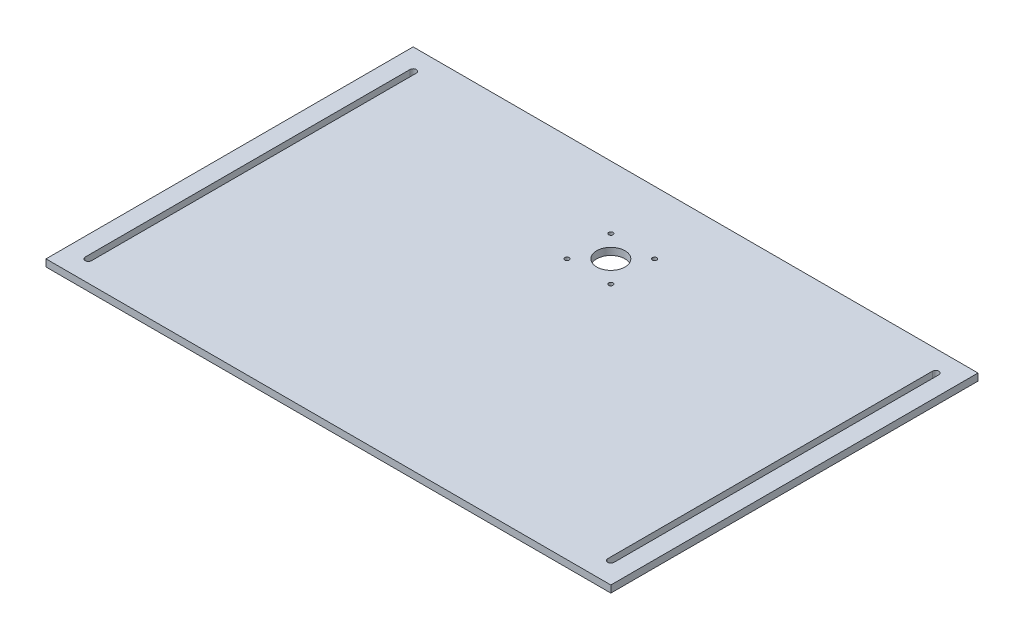
from build123d import *

# Parameters (mm, degrees)
SKETCH_1_W          = 400
SKETCH_1_H          = 260
EXTRUDE_1_DEPTH     = 5
CUT_EXTRUDE_1_DEPTH = 239.589605809
SKETCH_3_R          = 1.55
SKETCH_3_R_2        = 10
CUT_EXTRUDE_2_DEPTH = 239.589605809


with BuildPart() as part:
    # 草圖1 → 填料-伸長1 (new body)
    with BuildSketch(Plane(origin=(0, 0, 0), x_dir=(1, 0, 0), z_dir=(0, 1, 0))):
        Rectangle(SKETCH_1_W, SKETCH_1_H)
    extrude(amount=EXTRUDE_1_DEPTH)

    # 草圖2 → 除料-伸長1 (cut, through all)
    with BuildSketch(Plane(origin=(0, 5, 0), x_dir=(1, 0, 0), z_dir=(0, 1, 0))):
        with BuildLine():
            Line((-182.75, 115), (-182.75, -115))
            ThreePointArc((-182.75, -115), (-185, -117.25), (-187.25, -115))
            Line((-187.25, -115), (-187.25, 115))
            ThreePointArc((-187.25, 115), (-185, 117.25), (-182.75, 115))
        make_face()
        with BuildLine():
            Line((182.75, 115), (182.75, -115))
            ThreePointArc((182.75, -115), (185, -117.25), (187.25, -115))
            Line((187.25, -115), (187.25, 115))
            ThreePointArc((187.25, 115), (185, 117.25), (182.75, 115))
        make_face()
    extrude(amount=-CUT_EXTRUDE_1_DEPTH, mode=Mode.SUBTRACT)

    # 草圖3 → 除料-伸長2 (cut, through all)
    with BuildSketch(Plane(origin=(0, 5, 0), x_dir=(1, 0, 0), z_dir=(0, 1, 0))):
        with Locations((-15.5, 85.5)):
            Circle(SKETCH_3_R)
        with Locations((15.5, 85.5)):
            Circle(SKETCH_3_R)
        with Locations((-15.5, 54.5)):
            Circle(SKETCH_3_R)
        with Locations((15.5, 54.5)):
            Circle(SKETCH_3_R)
        with Locations((0, 70)):
            Circle(SKETCH_3_R_2)
    extrude(amount=-CUT_EXTRUDE_2_DEPTH, mode=Mode.SUBTRACT)


solid = part.part
